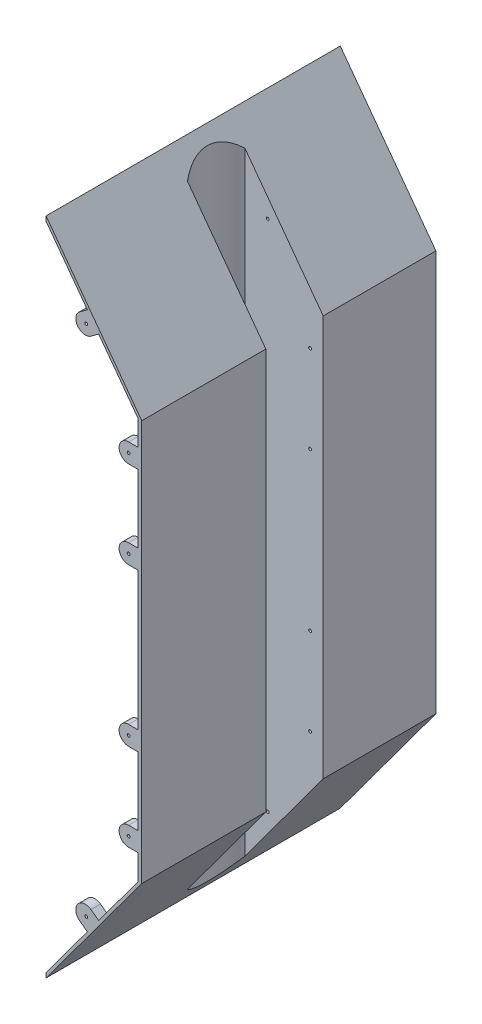
from build123d import *

# Parameters (mm, degrees)
BOSS_EXTRUDE1_DEPTH      = 308
CUT_EXTRUDE1_DEPTH       = 1070.094349131
CUT_EXTRUDE1_DEPTH_BACK  = 1070.094349131
SKETCH5_W                = 70
SKETCH5_H                = 419.715582198
CUT_EXTRUDE2_DEPTH       = 20
BOSS_EXTRUDE5_DEPTH      = 345
BOSS_EXTRUDE5_DEPTH_BACK = 345
SKETCH8_R                = 38.65
CUT_EXTRUDE3_DEPTH       = 20
SKETCH10_R               = 38.65
BOSS_EXTRUDE6_DEPTH      = 18
BOSS_EXTRUDE7_DEPTH      = 10
BOSS_EXTRUDE8_DEPTH      = 10
SKETCH13_R               = 1.5
CUT_EXTRUDE4_DEPTH       = 10
MIRROR4_START            = -308
MIRROR4_OUTLINE_R        = 1.5
MIRROR4_DEPTH            = 183
MIRROR5_START            = -195
MIRROR5_OUTLINE_R        = 1.5
MIRROR5_DEPTH            = 70
MIRROR5_START_2          = -308
MIRROR5_2_OUTLINE_R      = 1.5
MIRROR5_2_DEPTH          = 10


# Read off the part's stored shape, not the designer's step: Mirror4, Mirror5
with BuildPart() as part:
    # Sketch2 → Boss-Extrude1 (new body)
    with BuildSketch(Plane.XY):
        Polygon((863.58, -345.487717935), (963.71, -209.828898833), (963.71, 209.828898833), (863.58, 345.487717935), (863.58, 340.487717935), (960.019491684, 209.828898833), (960.019491684, -209.828898833), (863.58, -340.487717935), align=None)
    extrude(amount=-BOSS_EXTRUDE1_DEPTH)

    # Sketch4 → Cut-Extrude1 (cut, two sides: drawn at the far end of the back side and taken through both)
    with BuildSketch(Plane(origin=(0, 0, 0), x_dir=(1, 0, 0), z_dir=(0, 1, 0)).offset(-CUT_EXTRUDE1_DEPTH_BACK)):
        with BuildLine():
            Line((963.68867457, 125), (879.68867457, 125))
            ThreePointArc((879.68867457, 125), (865.192245817, 160), (879.68867457, 195))
            Line((879.68867457, 195), (963.68867457, 195))
            Line((963.68867457, 195), (963.68867457, 125))
        make_face()
    extrude(amount=CUT_EXTRUDE1_DEPTH + CUT_EXTRUDE1_DEPTH_BACK, mode=Mode.SUBTRACT)

    # Sketch5 → Cut-Extrude2 (cut)
    with BuildSketch(Plane(origin=(963.71, 0, 0), x_dir=(0, 0, -1), z_dir=(1, 0, 0))):
        with Locations((160, 0)):
            Rectangle(SKETCH5_W, SKETCH5_H)
    extrude(amount=-CUT_EXTRUDE2_DEPTH, mode=Mode.SUBTRACT)

    # Sketch6 → Boss-Extrude5 (add, two sides: drawn at the far end of the back side and taken through both)
    with BuildSketch(Plane(origin=(0, 0, 0), x_dir=(1, 0, 0), z_dir=(0, 1, 0)).offset(-BOSS_EXTRUDE5_DEPTH_BACK)):
        with BuildLine():
            Line((881.71, 190), (963.71, 190))
            Line((963.71, 190), (963.71, 195))
            Line((963.71, 195), (879.68867457, 195))
            ThreePointArc((879.68867457, 195), (865.192245817, 160), (879.68867457, 125))
            Line((879.68867457, 125), (963.71, 125))
            Line((963.71, 125), (963.71, 129.907432731))
            Line((963.71, 129.907432731), (881.71, 129.907432731))
            ThreePointArc((881.71, 129.907432731), (872.354471203, 159.953716366), (881.71, 190))
        make_face()
    extrude(amount=BOSS_EXTRUDE5_DEPTH + BOSS_EXTRUDE5_DEPTH_BACK)

    # SurfaceCut3
    split(bisect_by=Plane(origin=(724.099790673, 534.459259784, 0), x_dir=(0, 0, -1), z_dir=(0.8045716096402957, 0.5938556432002846, 0)), keep=Keep.BOTTOM)

    # SurfaceCut5
    split(bisect_by=Plane(origin=(724.099790673, -534.459259784, 0), x_dir=(0, 0, -1), z_dir=(0.8045716096402962, -0.5938556432002841, 0)), keep=Keep.BOTTOM)

    # Sketch8 → Cut-Extrude3 (cut)
    with BuildSketch(Plane(origin=(0, 0, -129.907432731), x_dir=(-1, 0, 0), z_dir=(0, 0, -1))):
        with Locations((-920.71, -0.171101167)):
            Circle(SKETCH8_R)
    extrude(amount=-CUT_EXTRUDE3_DEPTH, mode=Mode.SUBTRACT)

    # Sketch10 → Boss-Extrude6 (add)
    with BuildSketch(Plane.XY.offset(-125)):
        with BuildLine():
            Line((960.019491684, -18.750803247), (960.019491684, 18.408600914))
            ThreePointArc((960.019491684, 18.408600914), (918.457002221, 43.249694161), (879.68867457, 14.240433307))
            Line((879.68867457, 14.240433307), (879.68867457, -14.58263564))
            ThreePointArc((879.68867457, -14.58263564), (918.457002221, -43.591896494), (960.019491684, -18.750803247))
        make_face()
        with Locations(Location((920.71, -0.171101167, 0), (0, 0, 180))):
            Circle(SKETCH10_R, mode=Mode.SUBTRACT)
    extrude(amount=BOSS_EXTRUDE6_DEPTH)

    # Sketch11 → Boss-Extrude7 (add)
    with BuildSketch(Plane.XY.offset(-107)):
        with BuildLine():
            Line((960.019491684, -18.750803247), (960.019491684, 18.408600914))
            ThreePointArc((960.019491684, 18.408600914), (918.457002221, 43.249694161), (879.68867457, 14.240433307))
            Line((879.68867457, 14.240433307), (879.68867457, -14.58263564))
            ThreePointArc((879.68867457, -14.58263564), (918.457002221, -43.591896494), (960.019491684, -18.750803247))
        make_face()
    extrude(amount=BOSS_EXTRUDE7_DEPTH)

    # Sketch12 → Boss-Extrude8 (add)
    with BuildSketch(Plane.XY):
        with BuildLine():
            Line((906.776972219, 281.963297282), (898.731256122, 276.02474085))
            ThreePointArc((898.731256122, 276.02474085), (896.624096458, 262.040468322), (910.608368986, 259.933308657))
            Line((910.608368986, 259.933308657), (918.654085083, 265.871865089))
            Line((918.654085083, 265.871865089), (906.776972219, 281.963297282))
        make_face()
        with BuildLine():
            Line((960.019491684, 183.75453442), (950.019491684, 183.75453442))
            ThreePointArc((950.019491684, 183.75453442), (940.019491684, 173.75453442), (950.019491684, 163.75453442))
            Line((950.019491684, 163.75453442), (960.019491684, 163.75453442))
            Line((960.019491684, 163.75453442), (960.019491684, 183.75453442))
        make_face()
        with BuildLine():
            Line((960.019491684, 92.340523551), (950.019491684, 92.340523551))
            ThreePointArc((950.019491684, 92.340523551), (940.019491684, 82.340523551), (950.019491684, 72.340523551))
            Line((950.019491684, 72.340523551), (960.019491684, 72.340523551))
            Line((960.019491684, 72.340523551), (960.019491684, 92.340523551))
        make_face()
    boss_extrude8 = extrude(amount=-BOSS_EXTRUDE8_DEPTH)

    # Sketch13 → Cut-Extrude4 (cut)
    with BuildSketch(Plane.XY):
        with Locations((905.654330921, 268.705699397)):
            Circle(SKETCH13_R)
        with Locations((950.019491684, 173.75453442)):
            Circle(SKETCH13_R)
        with Locations((950.019491684, 82.340523551)):
            Circle(SKETCH13_R)
    cut_extrude4 = extrude(amount=-CUT_EXTRUDE4_DEPTH, mode=Mode.SUBTRACT)

    # Mirror1: Boss-Extrude8 across plane
    add(boss_extrude8.mirror(Plane.ZX.offset(-0.00546558)))

    # Mirror2: Cut-Extrude4 across plane
    add(cut_extrude4.mirror(Plane.ZX.offset(-0.00546558)), mode=Mode.SUBTRACT)

    # Mirror3: Boss-Extrude8 across plane
    add(boss_extrude8.mirror(Plane(origin=(0, 0, -154), x_dir=(1, 0, 0), z_dir=(0, 0, -1))))

    # Mirror4 outline → Mirror4 (cut)
    with BuildSketch(Plane.XY.offset(MIRROR4_START)):
        with Locations((950.019491684, 82.340523551)):
            Circle(MIRROR4_OUTLINE_R)
        with Locations((950.019491684, 173.75453442)):
            Circle(MIRROR4_OUTLINE_R)
        with Locations((905.654330921, 268.705699397)):
            Circle(MIRROR4_OUTLINE_R)
    extrude(amount=MIRROR4_DEPTH, mode=Mode.SUBTRACT)

    # Mirror5 outline → Mirror5 (cut)
    with BuildSketch(Plane.XY.offset(MIRROR5_START)):
        with Locations((950.019491684, -82.351454711)):
            Circle(MIRROR5_OUTLINE_R)
        with Locations((950.019491684, -173.76546558)):
            Circle(MIRROR5_OUTLINE_R)
        with Locations((905.654330921, -268.716630557)):
            Circle(MIRROR5_OUTLINE_R)
    extrude(amount=MIRROR5_DEPTH, mode=Mode.SUBTRACT)

    # Mirror5 2 outline → Mirror5 2 (add)
    # profile 1 of 3: a face of its own
    with BuildSketch(Plane.XY.offset(MIRROR5_START_2)):
        with BuildLine():
            ThreePointArc((910.608368986, -259.944239817), (896.624096458, -262.051399482), (898.731256122, -276.03567201))
            Line((898.731256122, -276.03567201), (906.771749317, -281.97037341))
            Line((906.771749317, -281.97037341), (918.648862181, -265.878941217))
            Line((918.648862181, -265.878941217), (910.608368986, -259.944239817))
        make_face()
        with Locations((905.654330921, -268.716630557)):
            Circle(MIRROR5_2_OUTLINE_R, mode=Mode.SUBTRACT)
    # profile 2 of 3: a face of its own
    with BuildSketch(Plane.XY.offset(MIRROR5_START_2)):
        with BuildLine():
            Line((950.019491684, -92.351454711), (960.019491684, -92.351454711))
            Line((960.019491684, -92.351454711), (960.019491684, -72.351454711))
            Line((960.019491684, -72.351454711), (950.019491684, -72.351454711))
            ThreePointArc((950.019491684, -72.351454711), (940.019491684, -82.351454711), (950.019491684, -92.351454711))
        make_face()
        with Locations((950.019491684, -82.351454711)):
            Circle(MIRROR5_2_OUTLINE_R, mode=Mode.SUBTRACT)
    # profile 3 of 3: a face of its own
    with BuildSketch(Plane.XY.offset(MIRROR5_START_2)):
        with BuildLine():
            Line((950.019491684, -183.76546558), (960.019491684, -183.76546558))
            Line((960.019491684, -183.76546558), (960.019491684, -163.76546558))
            Line((960.019491684, -163.76546558), (950.019491684, -163.76546558))
            ThreePointArc((950.019491684, -163.76546558), (940.019491684, -173.76546558), (950.019491684, -183.76546558))
        make_face()
        with Locations((950.019491684, -173.76546558)):
            Circle(MIRROR5_2_OUTLINE_R, mode=Mode.SUBTRACT)
    extrude(amount=MIRROR5_2_DEPTH)


solid = part.part
